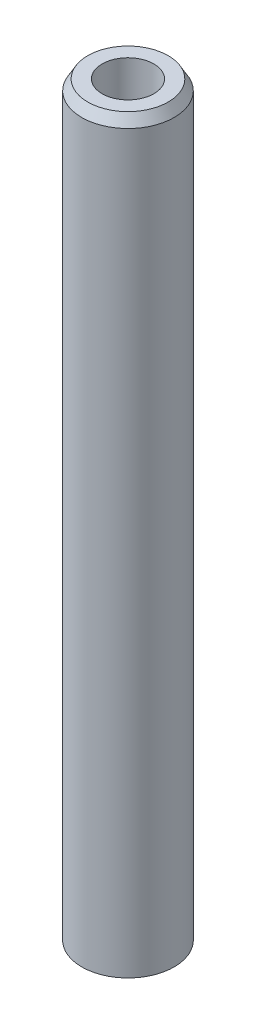
from build123d import *
from OCP.BRepFilletAPI import BRepFilletAPI_MakeChamfer

# Parameters (mm, degrees)
SKETCH1_R           = 7.5
BOSS_EXTRUDE1_DEPTH = 122.053708614
SKETCH2_R           = 4.198951994
CUT_EXTRUDE1_DEPTH  = 123.513704485
CHAMFER1_SIZE       = 1.686112884
CHAMFER1_SIZE2      = 0.973477727


with BuildPart() as part:
    # Sketch1 → Boss-Extrude1 (new body)
    with BuildSketch(Plane(origin=(0, 0, 0), x_dir=(1, 0, 0), z_dir=(0, 1, 0))):
        Circle(SKETCH1_R)
    extrude(amount=BOSS_EXTRUDE1_DEPTH)

    # Sketch2 → Cut-Extrude1 (cut, through all)
    with BuildSketch(Plane(origin=(0, 0, 0), x_dir=(1, 0, 0), z_dir=(0, 1, 0))):
        Circle(SKETCH2_R)
    extrude(amount=CUT_EXTRUDE1_DEPTH, mode=Mode.SUBTRACT)

    # Chamfer1: one chamfer whose edges measure the first distance from different faces: ONE call of the kernel's chamfer builder (chamfer() names one face for all edges)
    chamfer1_edges_1 = [part.edges().sort_by_distance(p)[0] for p in [
        (-7.5, 122.053708614, 0),
    ]]
    chamfer1_side_1 = [part.faces().sort_by_distance(p)[0] for p in [
        (-7.5, 61.026854307, 0),
    ]]
    chamfer1_edges_2 = [part.edges().sort_by_distance(p)[0] for p in [
        (-7.5, 0, 0),
    ]]
    chamfer1_side_2 = [part.faces().sort_by_distance(p)[0] for p in [
        (-7.287867966, 0, 0),
    ]]
    chamfer1 = BRepFilletAPI_MakeChamfer(part.part.solid().wrapped)
    for e in chamfer1_edges_1:
        chamfer1.Add(CHAMFER1_SIZE, CHAMFER1_SIZE2, e.wrapped, chamfer1_side_1[0].wrapped)  # the first distance lies on this face
    for e in chamfer1_edges_2:
        chamfer1.Add(CHAMFER1_SIZE, CHAMFER1_SIZE2, e.wrapped, chamfer1_side_2[0].wrapped)  # the first distance lies on this face
    add(Compound.cast(chamfer1.Shape()), mode=Mode.REPLACE)


solid = part.part
